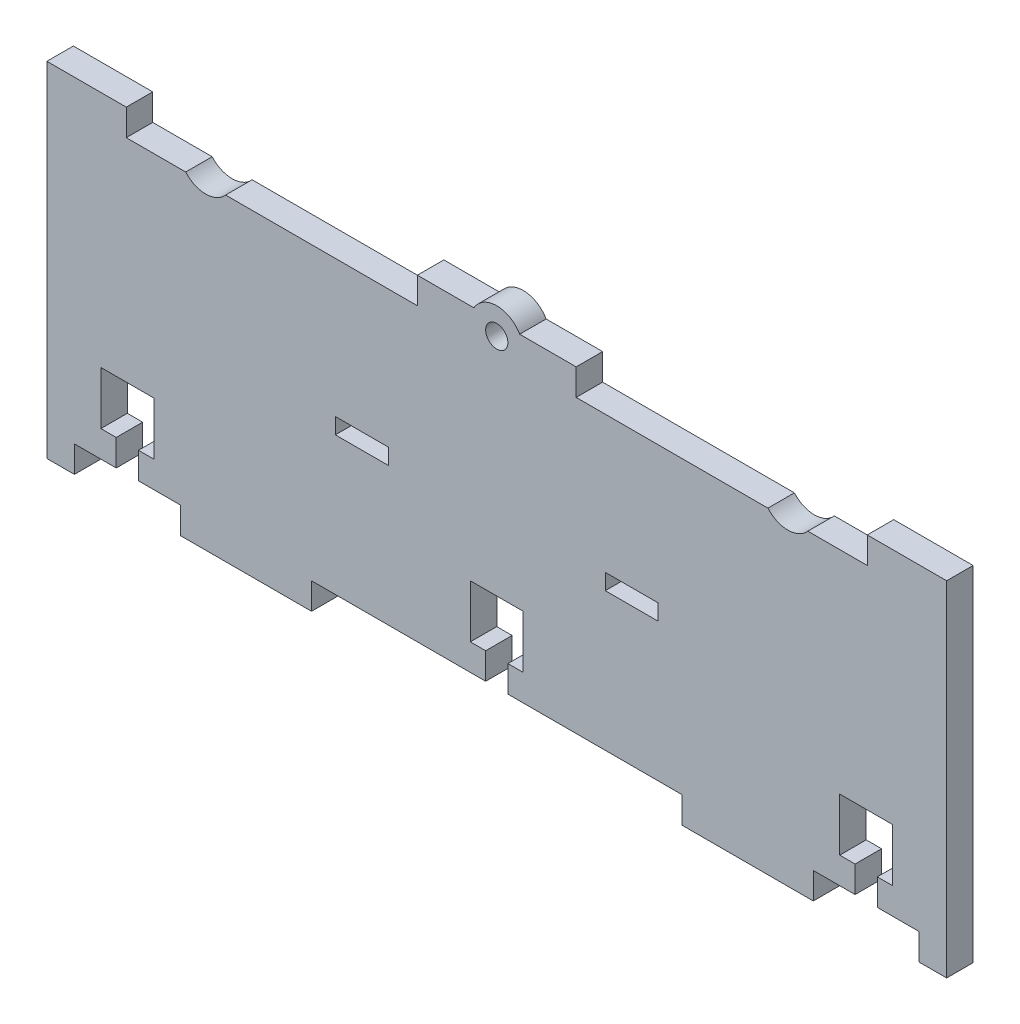
from build123d import *

# Parameters (mm, degrees)
BOSS_EXTRUDE1_DEPTH = 5
SKETCH2_W           = 35
SKETCH2_H           = 65
CUT_EXTRUDE1_DEPTH  = 10
CUT_EXTRUDE2_DEPTH  = 5
SKETCH4_W           = 30
SKETCH4_H           = 5
BOSS_EXTRUDE2_DEPTH = 5
SKETCH5_W           = 20
SKETCH5_H           = 5
CUT_EXTRUDE3_DEPTH  = 5
SKETCH6_R           = 2.1
CUT_EXTRUDE4_DEPTH  = 5
BOSS_EXTRUDE3_DEPTH = 5
CUT_EXTRUDE5_DEPTH  = 5
SKETCH9_W           = 10
SKETCH9_H           = 3
CUT_EXTRUDE6_DEPTH  = 10


with BuildPart() as part:
    # Sketch1 → Boss-Extrude1 (new body)
    with BuildSketch(Plane.XY):
        Polygon((95, -5), (95, 0), (115, 0), (115, 15), (120, 15), (120, 40), (115, 40), (115, 55), (100, 55), (100, 60), (70, 60), (70, 55), (-70, 55), (-70, 60), (-100, 60), (-100, 55), (-115, 55), (-115, 40), (-120, 40), (-120, 15), (-115, 15), (-115, 0), (-95, 0), (-95, -5), (-35, -5), (-35, 0), (35, 0), (35, -5), align=None)
    extrude(amount=BOSS_EXTRUDE1_DEPTH)

    # Sketch2 → Cut-Extrude1 (cut)
    with BuildSketch(Plane(origin=(0, 0, 0), x_dir=(-1, 0, 0), z_dir=(0, 0, -1))):
        with Locations((102.5, 27.5)):
            Rectangle(SKETCH2_W, SKETCH2_H)
        with Locations((-102.5, 27.5)):
            Rectangle(SKETCH2_W, SKETCH2_H)
    extrude(amount=-CUT_EXTRUDE1_DEPTH, mode=Mode.SUBTRACT)

    # Sketch3 → Cut-Extrude2 (cut)
    with BuildSketch(Plane(origin=(0, 0, 0), x_dir=(-1, 0, 0), z_dir=(0, 0, -1))):
        with BuildLine():
            Line((58.770676698, 55), (51.229323302, 55))
            ThreePointArc((51.229323302, 55), (55, 53.28359517), (58.770676698, 55))
        make_face()
        with BuildLine():
            Line((-51.229323302, 55), (-58.770676698, 55))
            ThreePointArc((-58.770676698, 55), (-55, 53.28359517), (-51.229323302, 55))
        make_face()
    extrude(amount=-CUT_EXTRUDE2_DEPTH, mode=Mode.SUBTRACT)

    # Sketch4 → Boss-Extrude2 (add)
    with BuildSketch(Plane(origin=(0, 55, 0), x_dir=(1, 0, 0), z_dir=(0, 1, 0))):
        with Locations((0, -2.5)):
            Rectangle(SKETCH4_W, SKETCH4_H)
    extrude(amount=BOSS_EXTRUDE2_DEPTH)

    # Sketch5 → Cut-Extrude3 (cut)
    with BuildSketch(Plane(origin=(0, 0, 0), x_dir=(-1, 0, 0), z_dir=(0, 0, -1))):
        with Locations((-69.8, -2.5)):
            Rectangle(SKETCH5_W, SKETCH5_H)
        with Locations((69.8, -2.5)):
            Rectangle(SKETCH5_W, SKETCH5_H)
    extrude(amount=-CUT_EXTRUDE3_DEPTH, mode=Mode.SUBTRACT)

    # Sketch6 → Cut-Extrude4 (cut)
    with BuildSketch(Plane(origin=(0, 0, 0), x_dir=(-1, 0, 0), z_dir=(0, 0, -1))):
        with Locations((0, 57.5)):
            Circle(SKETCH6_R)
    extrude(amount=-CUT_EXTRUDE4_DEPTH, mode=Mode.SUBTRACT)

    # Sketch7 → Boss-Extrude3 (add)
    with BuildSketch(Plane(origin=(0, 0, 0), x_dir=(-1, 0, 0), z_dir=(0, 0, -1))):
        with BuildLine():
            Line((4.330127019, 60), (-4.330127019, 60))
            ThreePointArc((-4.330127019, 60), (0, 62.5), (4.330127019, 60))
        make_face()
    extrude(amount=-BOSS_EXTRUDE3_DEPTH)

    # Sketch8 → Cut-Extrude5 (cut)
    with BuildSketch(Plane(origin=(0, 0, 0), x_dir=(-1, 0, 0), z_dir=(0, 0, -1))):
        Polygon((67.7, 5), (67.7, 0), (71.9, 0), (71.9, 5), (74.8, 5), (74.8, 15), (64.8, 15), (64.8, 5), align=None)
        Polygon((-2.1, 0), (2.1, 0), (2.1, 5), (5, 5), (5, 15), (-5, 15), (-5, 5), (-2.1, 5), align=None)
        Polygon((-67.7, 5), (-64.8, 5), (-64.8, 15), (-74.8, 15), (-74.8, 5), (-71.9, 5), (-71.9, 0), (-67.7, 0), align=None)
    extrude(amount=-CUT_EXTRUDE5_DEPTH, mode=Mode.SUBTRACT)

    # Sketch9 → Cut-Extrude6 (cut)
    with BuildSketch(Plane(origin=(0, 0, 0), x_dir=(-1, 0, 0), z_dir=(0, 0, -1))):
        with Locations((-25.5, 27.625214192)):
            Rectangle(SKETCH9_W, SKETCH9_H)
        with Locations((25.5, 27.625214192)):
            Rectangle(SKETCH9_W, SKETCH9_H)
    extrude(amount=-CUT_EXTRUDE6_DEPTH, mode=Mode.SUBTRACT)


solid = part.part
